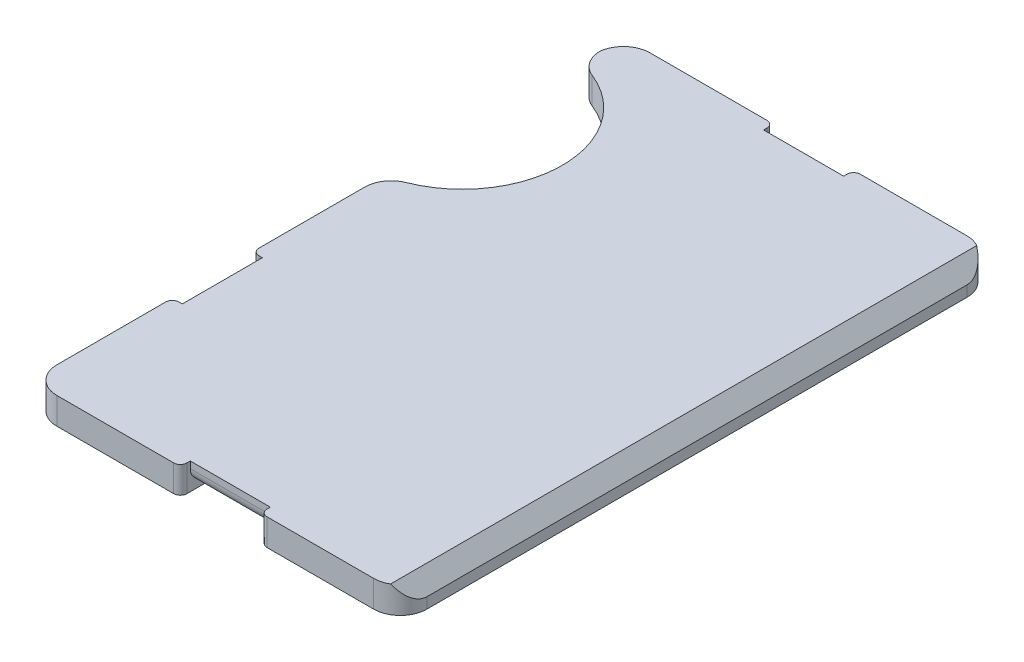
from build123d import *

# Parameters (mm, degrees)
SKETCH1_W           = 12
SKETCH1_H           = 54.196938457
SKETCH1_H_2         = 12
SKETCH1_W_2         = 21
SKETCH1_H_3         = 19.803061543
BOSS_EXTRUDE1_DEPTH = 4
SKETCH1_3_W         = 12
SKETCH1_3_H         = 54.196938457
SKETCH1_3_H_2       = 19.803061543
SKETCH1_3_H_3       = 12
SKETCH1_3_W_2       = 21
CUT_EXTRUDE3_DEPTH  = 1
SKETCH1_4_W         = 12
SKETCH1_4_H         = 12
CUT_EXTRUDE4_DEPTH  = 2
CHAMFER1_SIZE       = 2
FILLET2_R           = 4
CHAMFER2_SIZE       = 2
CHAMFER2_SIZE2      = 2.383507185
FILLET1_R           = 4
FILLET3_R           = 2
FILLET4_R           = 1
CUT_EXTRUDE6_DEPTH  = 0.5
CUT_EXTRUDE5_DEPTH  = 0.5


with BuildPart() as part:
    # Sketch1 → Boss-Extrude1 (new body)
    with BuildSketch(Plane(origin=(0, 0, 0), x_dir=(1, 0, 0), z_dir=(0, 1, 0))):
        with BuildLine():
            Line((-6, 43), (-6, 44.5))
            Line((-6, 44.5), (-28.5, 44.5))
            Line((-28.5, 44.5), (-28.5, 38))
            ThreePointArc((-28.5, 38), (-16.5, 23.303061543), (-28.5, 8.606123087))
            Line((-28.5, 8.606123087), (-28.5, -11.196938457))
            Line((-28.5, -11.196938457), (-27, -11.196938457))
            Line((-27, -11.196938457), (-6, -11.196938457))
            Line((-6, -11.196938457), (-6, 43))
        make_face()
        with Locations((0, 15.901530771)):
            Rectangle(SKETCH1_W, SKETCH1_H)
        Polygon((27, -44.5), (27, 44.5), (6, 44.5), (6, 43), (6, -11.196938457), (6, -23.196938457), (6, -43), (6, -44.5), align=None)
        with Locations((0, -17.196938457)):
            Rectangle(SKETCH1_W, SKETCH1_H_2)
        with Locations((-16.5, -17.196938457)):
            Rectangle(SKETCH1_W_2, SKETCH1_H_2)
        Polygon((-28.5, -44.5), (-6, -44.5), (-6, -43), (-6, -23.196938457), (-27, -23.196938457), (-28.5, -23.196938457), align=None)
        with Locations((0, -33.098469229)):
            Rectangle(SKETCH1_W, SKETCH1_H_3)
    extrude(amount=BOSS_EXTRUDE1_DEPTH)

    # Sketch1<3> → Cut-Extrude3 (cut)
    with BuildSketch(Plane(origin=(0, 0, 0), x_dir=(1, 0, 0), z_dir=(0, 1, 0))):
        with Locations((0, 15.901530771)):
            Rectangle(SKETCH1_3_W, SKETCH1_3_H)
        with Locations((0, -33.098469229)):
            Rectangle(SKETCH1_3_W, SKETCH1_3_H_2)
        with Locations((0, -17.196938457)):
            Rectangle(SKETCH1_3_W, SKETCH1_3_H_3)
        with Locations((-16.5, -17.196938457)):
            Rectangle(SKETCH1_3_W_2, SKETCH1_3_H_3)
    extrude(amount=CUT_EXTRUDE3_DEPTH, mode=Mode.SUBTRACT)

    # Sketch1<4> → Cut-Extrude4 (cut)
    with BuildSketch(Plane(origin=(0, 0, 0), x_dir=(1, 0, 0), z_dir=(0, 1, 0))):
        with Locations((0, -17.196938457)):
            Rectangle(SKETCH1_4_W, SKETCH1_4_H)
    extrude(amount=CUT_EXTRUDE4_DEPTH, mode=Mode.SUBTRACT)

    # Chamfer1
    # the kernel refuses this chamfer: 2 mm, written as the material it takes off along each edge
    with BuildSketch(Plane(origin=(-6, 1, 23.196938457), x_dir=(0, 1, 0), z_dir=(0, 0, -1))) as chamfer1_piece_1_section:
        Polygon((CHAMFER1_SIZE, 0), (0, -CHAMFER1_SIZE), (0, 0), align=None)
    chamfer1_piece_1 = extrude(amount=12, mode=Mode.PRIVATE)
    chamfer1_piece_1 = split(chamfer1_piece_1, bisect_by=Plane(origin=(-6, 2, 23.196938457), z_dir=(0, -1, 0)), keep=Keep.TOP, mode=Mode.PRIVATE)
    add(chamfer1_piece_1, mode=Mode.SUBTRACT)

    # Fillet2
    fillet2_edges = [part.edges().sort_by_distance(p)[0] for p in [
        (-28.5, 2, -8.606123087),
        (-28.5, 2, -38),
    ]]
    fillet(fillet2_edges, radius=FILLET2_R)

    # Chamfer2
    chamfer2_edges = [part.edges().sort_by_distance(p)[0] for p in [
        (27, 4, 0),
    ]]
    chamfer2_side = [part.faces().sort_by_distance(p)[0] for p in [
        (0.667186488, 4, 1.280693721),
    ]]
    chamfer(chamfer2_edges, length=CHAMFER2_SIZE, length2=CHAMFER2_SIZE2, reference=chamfer2_side[0])

    # Fillet1
    # the kernel refuses this fillet: 4 mm, written as the material it takes off along each edge
    with BuildSketch(Plane(origin=(-28.5, -10, 44.5), x_dir=(1, 0, 0), z_dir=(0, 1, 0))) as fillet1_piece_1:
        with BuildLine():
            CenterArc((FILLET1_R, FILLET1_R), FILLET1_R, 180, 90)
            Line((0, FILLET1_R), (-FILLET1_R * 0.02, FILLET1_R))
            Line((-FILLET1_R * 0.02, FILLET1_R), (-FILLET1_R * 0.02, -FILLET1_R * 0.02))
            Line((-FILLET1_R * 0.02, -FILLET1_R * 0.02), (FILLET1_R, -FILLET1_R * 0.02))
            Line((FILLET1_R, -FILLET1_R * 0.02), (FILLET1_R, 0))
        make_face()
    extrude(amount=24, mode=Mode.SUBTRACT)
    with BuildSketch(Plane(origin=(-28.5, -9.931735764, -44.5), x_dir=(1, 0, 0), z_dir=(0, 1, 0))) as fillet1_piece_2:
        with BuildLine():
            CenterArc((3.972694306, -4), FILLET1_R, 90, 83.301437518)
            Line((0, -3.533416724), (-0.079453886, -3.524085059))
            ThreePointArc((-0.079453886, -3.524085059), (-0.08, -1.766708362), (-0.08, 0))
            Line((-0.08, 0), (0, 0.08))
            Line((0, 0.08), (3.972694306, 0.08))
            Line((3.972694306, 0.08), (3.972694306, 0))
        make_face()
    extrude(amount=23.863471529, mode=Mode.SUBTRACT)
    with BuildSketch(Plane(origin=(27, -10, -44.5), x_dir=(-1, 0, 0), z_dir=(0, 1, 0))) as fillet1_piece_3:
        with BuildLine():
            CenterArc((FILLET1_R, FILLET1_R), FILLET1_R, 180, 90)
            Line((0, FILLET1_R), (-FILLET1_R * 0.02, FILLET1_R))
            Line((-FILLET1_R * 0.02, FILLET1_R), (-FILLET1_R * 0.02, -FILLET1_R * 0.02))
            Line((-FILLET1_R * 0.02, -FILLET1_R * 0.02), (FILLET1_R, -FILLET1_R * 0.02))
            Line((FILLET1_R, -FILLET1_R * 0.02), (FILLET1_R, 0))
        make_face()
    extrude(amount=21.616492815, mode=Mode.SUBTRACT)
    with BuildSketch(Plane(origin=(27, -10, 44.5), x_dir=(-1, 0, 0), z_dir=(0, 1, 0))) as fillet1_piece_4:
        with BuildLine():
            CenterArc((FILLET1_R, -FILLET1_R), FILLET1_R, 90, 90)
            Line((0, -FILLET1_R), (-FILLET1_R * 0.02, -FILLET1_R))
            Line((-FILLET1_R * 0.02, -FILLET1_R), (-FILLET1_R * 0.02, FILLET1_R * 0.02))
            Line((-FILLET1_R * 0.02, FILLET1_R * 0.02), (FILLET1_R, FILLET1_R * 0.02))
            Line((FILLET1_R, FILLET1_R * 0.02), (FILLET1_R, 0))
        make_face()
    extrude(amount=21.616492815, mode=Mode.SUBTRACT)

    # Fillet3
    fillet3_edges = [part.edges().sort_by_distance(p)[0] for p in [
        (0, 1, -43),
        (0, 1, 43),
    ]]
    fillet(fillet3_edges, radius=FILLET3_R)

    # Fillet4
    fillet4_edges = [part.edges().sort_by_distance(p)[0] for p in [
        (-6, 2, 44.5),
        (-28.5, 2, 23.196938457),
        (-28.5, 2, 11.196938457),
        (-6, 2, -44.5),
        (6, 2, -44.5),
        (6, 2, 44.5),
    ]]
    fillet(fillet4_edges, radius=FILLET4_R)

    # Sketch3 → Cut-Extrude6 (cut)
    with BuildSketch(Plane.XZ):
        Polygon((26, 6.846975509), (26, -2.047005384), (22.5, -0.026279442), (22.5, 7.713000913), (18.5, 10.022401989), (18.5, 2.283121635), (16.5, 3.437822174), (16.5, 12.331803066), align=None)
        Polygon((9, 7.767949192), (9, 18.971331162), (26, 9.156376586), (26, 12.620478201), (9, 22.435432777), (9, 25.855728078), (13.872673559, 23.042488687), (13.872673559, 33.014498231), (11.872673559, 34.16919877), (11.872673559, 25.351889764), (7, 28.165129155), (7, 8.922649731), align=None)
        Polygon((14.5, 4.592522712), (11, 6.613248654), (11, 15.507229547), (14.5, 13.486503605), align=None)
        Polygon((26, 19.084579816), (21.241040405, 21.832166419), (21.241040405, 18.832166419), (26, 16.084579816), align=None)
        Polygon((18.5, 26.87880845), (18.5, 19.260006297), (16.5, 20.414706835), (16.5, 31.497610604), (26, 26.012783046), (26, 22.548681431), align=None)
        Polygon((26, 34.095686815), (26, 28.322184123), (9, 38.137138699), (9, 29.742507874), (7, 30.897208412), (7, 40.446539776), (22.5, 31.497610604), (22.5, 34.961712219), (13.872673559, 39.942701462), (13.872673559, 43.5), (15.872673559, 43.5), (15.872673559, 39.942701462), align=None)
        Polygon((26, 36.405087892), (18.855212659, 40.530132787), (18.855212659, 43.5), (22.355212659, 43.5), (22.355212659, 39.664107383), (26, 37.55978843), align=None)
        Polygon((12.038363906, 41.001740633), (7.711251753, 43.5), (12.038363906, 43.5), align=None)
    extrude(amount=-CUT_EXTRUDE6_DEPTH, mode=Mode.SUBTRACT)

    # Sketch2 → Cut-Extrude5 (cut)
    # profile 1 of 3: a face of its own
    with BuildSketch(Plane.XZ):
        with BuildLine():
            Line((21.258663757, -19.559912495), (21.258663757, -31.236746335))
            ThreePointArc((21.258663757, -31.236746335), (16.804977927, -25.398329415), (21.258663757, -19.559912495))
        make_face()
        with BuildLine():
            ThreePointArc((20.558663757, -20.563874743), (17.504977927, -25.398329415), (20.558663757, -30.232784086))
            Line((20.558663757, -30.232784086), (20.558663757, -28.325034046))
            Line((20.558663757, -28.325034046), (20.558663757, -22.471624783))
            Line((20.558663757, -22.471624783), (20.558663757, -20.563874743))
        make_face(mode=Mode.SUBTRACT)
    # profile 2 of 3: a face of its own
    with BuildSketch(Plane.XZ):
        with BuildLine():
            Line((20.558663757, -22.471624783), (20.558663757, -28.325034046))
            ThreePointArc((20.558663757, -28.325034046), (18.838663757, -25.398329415), (20.558663757, -22.471624783))
        make_face()
    # profile 3 of 3: a face of its own
    with BuildSketch(Plane.XZ):
        with BuildLine():
            ThreePointArc((20.075747841, -19.354579409), (16.204977927, -25.398329415), (20.075747841, -31.442079421))
            ThreePointArc((20.075747841, -31.442079421), (20.402353273, -32.080361375), (19.859139802, -32.548329415))
            Line((19.859139802, -32.548329415), (11.741336243, -32.548329415))
            Line((11.741336243, -32.548329415), (11.741336243, -31.348329415))
            Line((11.741336243, -31.348329415), (17.887029825, -31.348329415))
            ThreePointArc((17.887029825, -31.348329415), (16.002102254, -29.018717282), (15.141336243, -26.148329415))
            Line((15.141336243, -26.148329415), (11.741336243, -26.148329415))
            Line((11.741336243, -26.148329415), (11.741336243, -24.648329415))
            Line((11.741336243, -24.648329415), (15.141336243, -24.648329415))
            ThreePointArc((15.141336243, -24.648329415), (16.002102254, -21.777941547), (17.887029825, -19.448329415))
            Line((17.887029825, -19.448329415), (11.741336243, -19.448329415))
            Line((11.741336243, -19.448329415), (11.741336243, -18.248329415))
            Line((11.741336243, -18.248329415), (19.859139802, -18.248329415))
            ThreePointArc((19.859139802, -18.248329415), (20.402353273, -18.716297455), (20.075747841, -19.354579409))
        make_face()
    extrude(amount=-CUT_EXTRUDE5_DEPTH, mode=Mode.SUBTRACT)


solid = part.part
